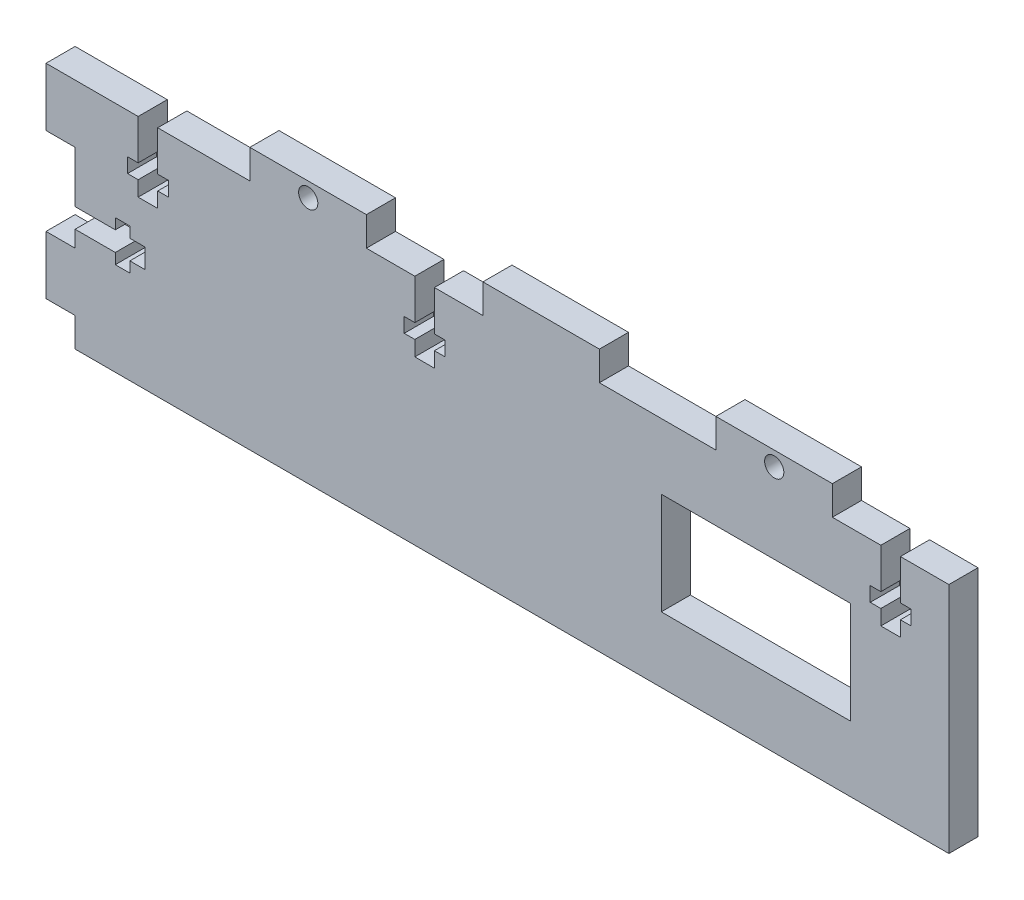
from build123d import *

# Parameters (mm, degrees)
SKETCH1_W           = 190.5
SKETCH1_H           = 50.8
BOSS_EXTRUDE1_DEPTH = 6.35
SKETCH2_W           = 41.275
SKETCH2_H           = 22.225
CUT_EXTRUDE1_DEPTH  = 151.724377554
SKETCH3_W           = 25.4
SKETCH3_H           = 6.35
BOSS_EXTRUDE2_DEPTH = 6.35
LPATTERN1_COUNT     = 3
LPATTERN1_PITCH     = 50.8
SKETCH4_W           = 6.35
SKETCH4_H           = 12.7
BOSS_EXTRUDE3_DEPTH = 6.35
LPATTERN2_COUNT     = 2
LPATTERN2_PITCH     = 31.75
CUT_EXTRUDE2_DEPTH  = 6.35
SKETCH6_R           = 2.0955
CUT_EXTRUDE3_DEPTH  = 159.133368044
CUT_EXTRUDE4_DEPTH  = 159.133368044


with BuildPart() as part:
    # Sketch1 → Boss-Extrude1 (new body)
    with BuildSketch(Plane.XY):
        with Locations((-53.183, 0)):
            Rectangle(SKETCH1_W, SKETCH1_H)
    extrude(amount=BOSS_EXTRUDE1_DEPTH)

    # Sketch2 → Cut-Extrude1 (cut, through all)
    with BuildSketch(Plane.XY.offset(6.35)):
        Rectangle(SKETCH2_W, SKETCH2_H)
    extrude(amount=-CUT_EXTRUDE1_DEPTH, mode=Mode.SUBTRACT)

    # Sketch3 → Boss-Extrude2 (add)
    with BuildSketch(Plane(origin=(0, 25.4, 0), x_dir=(1, 0, 0), z_dir=(0, 1, 0))):
        with Locations((3.967, -3.175)):
            Rectangle(SKETCH3_W, SKETCH3_H)
    boss_extrude2 = extrude(amount=BOSS_EXTRUDE2_DEPTH)

    # LPattern1: Boss-Extrude2 ×3
    with Locations(*[(-i * LPATTERN1_PITCH, 0, 0) for i in range(1, LPATTERN1_COUNT)]):
        add(boss_extrude2)

    # Sketch4 → Boss-Extrude3 (add)
    with BuildSketch(Plane.ZY.offset(148.433)):
        with Locations((3.175, 19.05)):
            Rectangle(SKETCH4_W, SKETCH4_H)
    boss_extrude3 = extrude(amount=BOSS_EXTRUDE3_DEPTH)

    # LPattern2: Boss-Extrude3 ×2
    with Locations(*[(0, -i * LPATTERN2_PITCH, 0) for i in range(1, LPATTERN2_COUNT)]):
        add(boss_extrude3)

    # Sketch5 → Cut-Extrude2 (cut)
    with BuildSketch(Plane.XY.offset(6.35)):
        Polygon((31.5006, 25.4), (27.2334, 25.4), (27.2334, 16.637), (24.922, 16.637), (24.922, 13.462), (27.2334, 13.462), (27.2334, 10.16), (31.5006, 10.16), (31.5006, 13.462), (33.812, 13.462), (33.812, 16.637), (31.5006, 16.637), align=None)
        Polygon((-70.0994, 25.4), (-74.3666, 25.4), (-74.3666, 16.637), (-76.678, 16.637), (-76.678, 13.462), (-74.3666, 13.462), (-74.3666, 10.16), (-70.0994, 10.16), (-70.0994, 13.462), (-67.788, 13.462), (-67.788, 16.637), (-70.0994, 16.637), align=None)
        Polygon((-130.4244, 25.4), (-134.6916, 25.4), (-134.6916, 16.637), (-137.003, 16.637), (-137.003, 13.462), (-134.6916, 13.462), (-134.6916, 10.16), (-130.4244, 10.16), (-130.4244, 13.462), (-128.113, 13.462), (-128.113, 16.637), (-130.4244, 16.637), align=None)
    extrude(amount=-CUT_EXTRUDE2_DEPTH, mode=Mode.SUBTRACT)

    # Sketch6 → Cut-Extrude3 (cut, through all)
    with BuildSketch(Plane(origin=(0, 0, 0), x_dir=(-1, 0, 0), z_dir=(0, 0, -1))):
        with Locations((-3.98760291, 28.575)):
            Circle(SKETCH6_R)
        with Locations((97.61239709, 28.575)):
            Circle(SKETCH6_R)
    extrude(amount=-CUT_EXTRUDE3_DEPTH, mode=Mode.SUBTRACT)

    # Sketch7 → Cut-Extrude4 (cut, through all)
    with BuildSketch(Plane.XY.offset(6.35)):
        Polygon((-148.433, 1.4986), (-148.433, -2.7686), (-139.67, -2.7686), (-139.67, -5.08), (-136.495, -5.08), (-136.495, -2.7686), (-133.193, -2.7686), (-133.193, 1.4986), (-136.495, 1.4986), (-136.495, 3.81), (-139.67, 3.81), (-139.67, 1.4986), align=None)
    extrude(amount=-CUT_EXTRUDE4_DEPTH, mode=Mode.SUBTRACT)


solid = part.part
